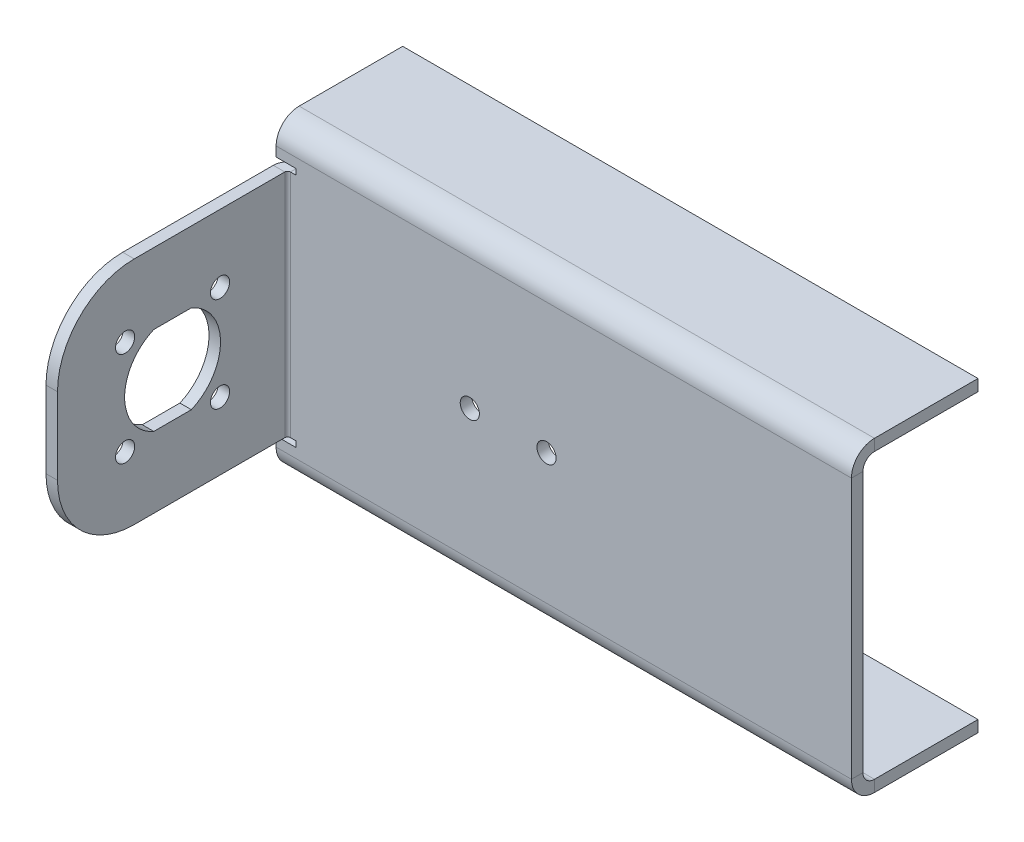
from build123d import *

# Parameters (mm, degrees)
SCHIZZO1_W                       = 150
SCHIZZO1_H                       = 80
BASE_FLANGIA1_DEPTH              = 3
BORDO_FLANGIA1_STRIP_W           = 18
BORDO_FLANGIA1_STRIP_H           = 3
BORDO_FLANGIA1_STRIP_CUT_DEPTH   = 150
BORDO_FLANGIA1_STRIP_2_W         = 18
BORDO_FLANGIA1_STRIP_2_H         = 3
BORDO_FLANGIA1_STRIP_CUT_2_DEPTH = 150
BORDO_FLANGIA1_DEPTH             = 150
BORDO_FLANGIA1_BEND_DEPTH        = 150
BORDO_FLANGIA3_STRIP_W           = 13.4732
BORDO_FLANGIA3_STRIP_H           = 3
BORDO_FLANGIA3_STRIP_CUT_DEPTH   = 60
BORDO_FLANGIA3_RELIEF_W          = 14.9732
BORDO_FLANGIA3_RELIEF_H          = 1.5
BORDO_FLANGIA3_RELIEF_CUT_DEPTH  = 3
BORDO_FLANGIA3_DEPTH             = 60
SCHIZZO28_R                      = 2.5
TAGLIO_ESTRUSIONE1_DEPTH         = 3
SCHIZZO30_R                      = 2.5
TAGLIO_ESTRUSIONE2_DEPTH         = 3


# Sheet-metal steps are written as plain solids
with BuildPart() as part:
    # Schizzo1 → Base-Flangia1 (new body)
    with BuildSketch(Plane.XY):
        Rectangle(SCHIZZO1_W, SCHIZZO1_H)
    extrude(amount=-BASE_FLANGIA1_DEPTH)

    # Bordo-Flangia1 strip (across the edge) → Bordo-Flangia1 strip cut (cut)
    with BuildSketch(Plane(origin=(-75, 40, -3), x_dir=(0, -1, 0), z_dir=(1, 0, 0))):
        with Locations((-3, -1.5)):
            Rectangle(BORDO_FLANGIA1_STRIP_W, BORDO_FLANGIA1_STRIP_H)
    extrude(amount=BORDO_FLANGIA1_STRIP_CUT_DEPTH, mode=Mode.SUBTRACT)

    # Bordo-Flangia1 strip 2 (across the edge) → Bordo-Flangia1 strip cut 2 (cut)
    with BuildSketch(Plane(origin=(75, -40, -3), x_dir=(0, 1, 0), z_dir=(-1, 0, 0))):
        with Locations((-3, -1.5)):
            Rectangle(BORDO_FLANGIA1_STRIP_2_W, BORDO_FLANGIA1_STRIP_2_H)
    extrude(amount=BORDO_FLANGIA1_STRIP_CUT_2_DEPTH, mode=Mode.SUBTRACT)

    # Bordo-Flangia1 section (across the edge) → Bordo-Flangia1 (add)
    with BuildSketch(Plane(origin=(-75, 40, -3), x_dir=(0, -1, 0), z_dir=(1, 0, 0))):
        with BuildLine():
            Line((0, 3), (0, 30))
            Line((0, 30), (3, 30))
            Line((3, 30), (3, 3))
            ThreePointArc((3, 3), (3.878679656, 0.878679656), (6, 0))
            Line((6, 0), (6, -3))
            ThreePointArc((6, -3), (1.757359313, -1.242640687), (0, 3))
        make_face()
    extrude(amount=BORDO_FLANGIA1_DEPTH)

    # Bordo-Flangia1 section 2 (across the edge) → Bordo-Flangia1 bend (add)
    with BuildSketch(Plane(origin=(75, -40, -3), x_dir=(0, 1, 0), z_dir=(-1, 0, 0))):
        with BuildLine():
            Line((0, 3), (0, 30))
            Line((0, 30), (3, 30))
            Line((3, 30), (3, 3))
            ThreePointArc((3, 3), (3.878679656, 0.878679656), (6, 0))
            Line((6, 0), (6, -3))
            ThreePointArc((6, -3), (1.757359313, -1.242640687), (0, 3))
        make_face()
    extrude(amount=BORDO_FLANGIA1_BEND_DEPTH)

    # Bordo-Flangia3 strip (across the edge) → Bordo-Flangia3 strip cut (cut)
    with BuildSketch(Plane(origin=(-75, 30, 0), x_dir=(1, 0, 0), z_dir=(0, -1, 0))):
        with Locations((-3, -1.5)):
            Rectangle(BORDO_FLANGIA3_STRIP_W, BORDO_FLANGIA3_STRIP_H)
    extrude(amount=BORDO_FLANGIA3_STRIP_CUT_DEPTH, mode=Mode.SUBTRACT)

    # Bordo-Flangia3 relief (on the sheet) → Bordo-Flangia3 relief cut (cut)
    with BuildSketch(Plane(origin=(-71.2634, 30, 0), x_dir=(1, 0, 0), z_dir=(0, 0, 1))):
        with Locations((-5.9866, 0.75)):
            Rectangle(BORDO_FLANGIA3_RELIEF_W, BORDO_FLANGIA3_RELIEF_H)
        with Locations((-5.9866, -60.75)):
            Rectangle(BORDO_FLANGIA3_RELIEF_W, BORDO_FLANGIA3_RELIEF_H)
    extrude(amount=-BORDO_FLANGIA3_RELIEF_CUT_DEPTH, mode=Mode.SUBTRACT)

    # Bordo-Flangia3 section (across the edge) → Bordo-Flangia3 (add)
    with BuildSketch(Plane(origin=(-75, 30, 0), x_dir=(1, 0, 0), z_dir=(0, -1, 0))):
        with BuildLine():
            Line((0, 0.7366), (0, 60))
            Line((0, 60), (3, 60))
            Line((3, 60), (3, 0.7366))
            ThreePointArc((3, 0.7366), (3.215745145, 0.215745145), (3.7366, 0))
            Line((3.7366, 0), (3.7366, -3))
            ThreePointArc((3.7366, -3), (1.094424801, -1.905575199), (0, 0.7366))
        make_face()
    extrude(amount=BORDO_FLANGIA3_DEPTH)

    # Schizzo28 → Taglio-Estrusione1 (cut)
    with BuildSketch(Plane(origin=(-72, 0, 0), x_dir=(0, 0, -1), z_dir=(1, 0, 0))):
        with BuildLine():
            Line((-60, 30), (-60, 10))
            ThreePointArc((-60, 10), (-54.142135624, 24.142135624), (-40, 30))
            Line((-40, 30), (-60, 30))
        make_face()
        with BuildLine():
            ThreePointArc((-40, -30), (-54.142135624, -24.142135624), (-60, -10))
            Line((-60, -10), (-60, -30))
            Line((-60, -30), (-40, -30))
        make_face()
        with BuildLine():
            Line((-34.898979486, -11.5), (-25.101020514, -11.5))
            ThreePointArc((-25.101020514, -11.5), (-17.5, 0), (-25.101020514, 11.5))
            Line((-25.101020514, 11.5), (-34.898979486, 11.5))
            ThreePointArc((-34.898979486, 11.5), (-42.5, 0), (-34.898979486, -11.5))
        make_face()
        with Locations((-42.374368671, 12.374368671)):
            Circle(SCHIZZO28_R)
        with Locations((-17.625631329, 12.374368671)):
            Circle(SCHIZZO28_R)
        with Locations((-17.625631329, -12.374368671)):
            Circle(SCHIZZO28_R)
        with Locations((-42.374368671, -12.374368671)):
            Circle(SCHIZZO28_R)
    extrude(amount=-TAGLIO_ESTRUSIONE1_DEPTH, mode=Mode.SUBTRACT)

    # Schizzo30 → Taglio-Estrusione2 (cut)
    with BuildSketch(Plane.XY):
        with Locations((-24.5, 0)):
            Circle(SCHIZZO30_R)
        with Locations((-4.5, 0)):
            Circle(SCHIZZO30_R)
    extrude(amount=-TAGLIO_ESTRUSIONE2_DEPTH, mode=Mode.SUBTRACT)


solid = part.part
